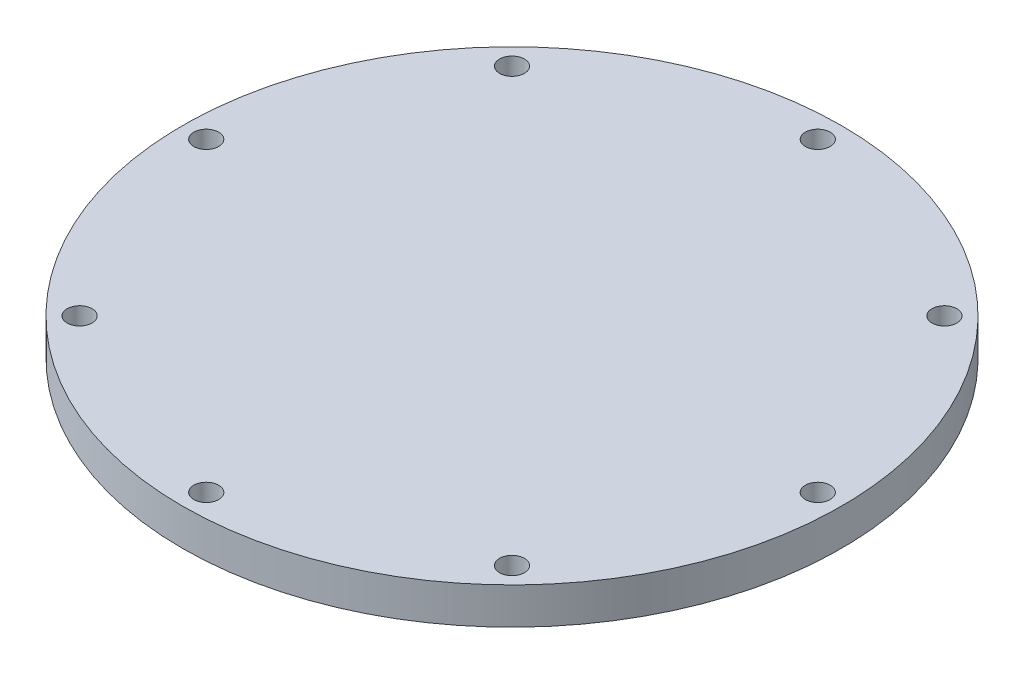
from build123d import *

# Parameters (mm, degrees)
SKETCH1_R             = 45
SKETCH1_R_2           = 1.5
BOSS_EXTRUDE2_DEPTH   = 5
SKETCH9_R             = 3.937
BOSS_EXTRUDE7_DEPTH   = 4
SKETCH10_R            = 1.7
CUT_EXTRUDE9_DEPTH    = 14
M3_TAPPED_HOLE1_D     = 2.5
M3_TAPPED_HOLE1_DEPTH = 7
M3_TAPPED_HOLE1_TIP   = 0.751075774


with BuildPart() as part:
    # Sketch1 → Boss-Extrude2 (new body)
    with BuildSketch(Plane(origin=(0, 0, 0), x_dir=(1, 0, 0), z_dir=(0, 1, 0))):
        Circle(SKETCH1_R)
        with Locations((0, 41.75)):
            Circle(SKETCH1_R_2, mode=Mode.SUBTRACT)
        with Locations((29.521708115, 29.521708115)):
            Circle(SKETCH1_R_2, mode=Mode.SUBTRACT)
        with Locations((41.75, 0)):
            Circle(SKETCH1_R_2, mode=Mode.SUBTRACT)
        with Locations((29.521708115, -29.521708115)):
            Circle(SKETCH1_R_2, mode=Mode.SUBTRACT)
        with Locations((0, -41.75)):
            Circle(SKETCH1_R_2, mode=Mode.SUBTRACT)
        with Locations((-29.521708115, -29.521708115)):
            Circle(SKETCH1_R_2, mode=Mode.SUBTRACT)
        with Locations((-41.75, 0)):
            Circle(SKETCH1_R_2, mode=Mode.SUBTRACT)
        with Locations((-29.521708115, 29.521708115)):
            Circle(SKETCH1_R_2, mode=Mode.SUBTRACT)
    extrude(amount=BOSS_EXTRUDE2_DEPTH)

    # Sketch9 → Boss-Extrude7 (add)
    with BuildSketch(Plane.XZ):
        with Locations((27, 0)):
            Circle(SKETCH9_R)
        with Locations((0, -27)):
            Circle(SKETCH9_R)
        with Locations((-27, 0)):
            Circle(SKETCH9_R)
        with Locations((0, 27)):
            Circle(SKETCH9_R)
    extrude(amount=BOSS_EXTRUDE7_DEPTH)

    # Sketch10 → Cut-Extrude9 (cut)
    with BuildSketch(Plane(origin=(0, 5, 0), x_dir=(1, 0, 0), z_dir=(0, 1, 0))):
        with Locations((0, 41.75)):
            Circle(SKETCH10_R)
        with Locations((29.521708115, 29.521708115)):
            Circle(SKETCH10_R)
        with Locations((41.75, 0)):
            Circle(SKETCH10_R)
        with Locations((29.521708115, -29.521708115)):
            Circle(SKETCH10_R)
        with Locations((0, -41.75)):
            Circle(SKETCH10_R)
        with Locations((-29.521708115, -29.521708115)):
            Circle(SKETCH10_R)
        with Locations((-41.75, 0)):
            Circle(SKETCH10_R)
        with Locations((-29.521708115, 29.521708115)):
            Circle(SKETCH10_R)
    extrude(amount=-CUT_EXTRUDE9_DEPTH, mode=Mode.SUBTRACT)

    # M3 Tapped Hole1
    with Locations(Plane.XZ.offset(4)):
        with Locations((0, 27), (27, 0), (0, -27), (-27, 0)):
            Hole(M3_TAPPED_HOLE1_D / 2, depth=M3_TAPPED_HOLE1_DEPTH)
            with Locations((0, 0, -(M3_TAPPED_HOLE1_DEPTH + M3_TAPPED_HOLE1_TIP / 2))):  # 118° drill point
                Cone(0, M3_TAPPED_HOLE1_D / 2, M3_TAPPED_HOLE1_TIP, mode=Mode.SUBTRACT)


solid = part.part
